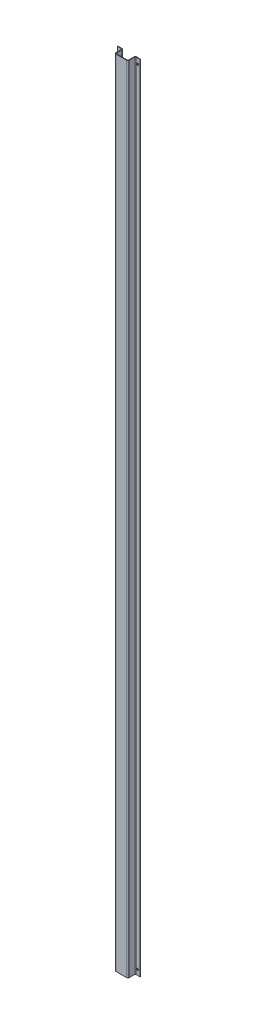
from build123d import *

# Parameters (mm, degrees)
SKETCH1_W                      = 50
SKETCH1_H                      = 3000
BASE_FLANGE1_DEPTH             = 2
EDGE_FLANGE1_STRIP_W           = 13
EDGE_FLANGE1_STRIP_H           = 2
EDGE_FLANGE1_STRIP_CUT_DEPTH   = 3000
EDGE_FLANGE1_STRIP_2_W         = 13
EDGE_FLANGE1_STRIP_2_H         = 2
EDGE_FLANGE1_STRIP_CUT_2_DEPTH = 3000
EDGE_FLANGE1_DEPTH             = 3000
EDGE_FLANGE1_BEND_DEPTH        = 3000
EDGE_FLANGE2_STRIP_W           = 13
EDGE_FLANGE2_STRIP_H           = 2
EDGE_FLANGE2_STRIP_CUT_DEPTH   = 3000
EDGE_FLANGE2_STRIP_2_W         = 13
EDGE_FLANGE2_STRIP_2_H         = 2
EDGE_FLANGE2_STRIP_CUT_2_DEPTH = 3000
EDGE_FLANGE2_DEPTH             = 3000
EDGE_FLANGE2_BEND_DEPTH        = 3000
SKETCH18_R                     = 3.5
CUT_EXTRUDE1_DEPTH             = 10
MIRROR2_COPY_1_SKETCH_R        = 3.5
MIRROR2_COPY_1_DEPTH           = 10


# Sheet-metal steps are written as plain solids
with BuildPart() as part:
    # Sketch1 → Base-Flange1 (new body)
    with BuildSketch(Plane.XY):
        Rectangle(SKETCH1_W, SKETCH1_H)
    extrude(amount=-BASE_FLANGE1_DEPTH)

    # Edge-Flange1 strip (across the edge) → Edge-Flange1 strip cut (cut)
    with BuildSketch(Plane(origin=(25, 1500, -2), x_dir=(-1, 0, 0), z_dir=(0, -1, 0))):
        with Locations((-2, -1)):
            Rectangle(EDGE_FLANGE1_STRIP_W, EDGE_FLANGE1_STRIP_H)
    extrude(amount=EDGE_FLANGE1_STRIP_CUT_DEPTH, mode=Mode.SUBTRACT)

    # Edge-Flange1 strip 2 (across the edge) → Edge-Flange1 strip cut 2 (cut)
    with BuildSketch(Plane(origin=(-25, -1500, -2), x_dir=(1, 0, 0), z_dir=(0, 1, 0))):
        with Locations((-2, -1)):
            Rectangle(EDGE_FLANGE1_STRIP_2_W, EDGE_FLANGE1_STRIP_2_H)
    extrude(amount=EDGE_FLANGE1_STRIP_CUT_2_DEPTH, mode=Mode.SUBTRACT)

    # Edge-Flange1 section (across the edge) → Edge-Flange1 (add)
    with BuildSketch(Plane(origin=(25, 1500, -2), x_dir=(-1, 0, 0), z_dir=(0, -1, 0))):
        with BuildLine():
            Line((0, 2.5), (0, 28))
            Line((0, 28), (2, 28))
            Line((2, 28), (2, 2.5))
            ThreePointArc((2, 2.5), (2.732233047, 0.732233047), (4.5, 0))
            Line((4.5, 0), (4.5, -2))
            ThreePointArc((4.5, -2), (1.318019485, -0.681980515), (0, 2.5))
        make_face()
    extrude(amount=EDGE_FLANGE1_DEPTH)

    # Edge-Flange1 section 2 (across the edge) → Edge-Flange1 bend (add)
    with BuildSketch(Plane(origin=(-25, -1500, -2), x_dir=(1, 0, 0), z_dir=(0, 1, 0))):
        with BuildLine():
            Line((0, 2.5), (0, 28))
            Line((0, 28), (2, 28))
            Line((2, 28), (2, 2.5))
            ThreePointArc((2, 2.5), (2.732233047, 0.732233047), (4.5, 0))
            Line((4.5, 0), (4.5, -2))
            ThreePointArc((4.5, -2), (1.318019485, -0.681980515), (0, 2.5))
        make_face()
    extrude(amount=EDGE_FLANGE1_BEND_DEPTH)

    # Edge-Flange2 strip (across the edge) → Edge-Flange2 strip cut (cut)
    with BuildSketch(Plane(origin=(-25, 1500, -30), x_dir=(0, 0, 1), z_dir=(0, -1, 0))):
        with Locations((-2, -1)):
            Rectangle(EDGE_FLANGE2_STRIP_W, EDGE_FLANGE2_STRIP_H)
    extrude(amount=EDGE_FLANGE2_STRIP_CUT_DEPTH, mode=Mode.SUBTRACT)

    # Edge-Flange2 strip 2 (across the edge) → Edge-Flange2 strip cut 2 (cut)
    with BuildSketch(Plane(origin=(25, -1500, -30), x_dir=(0, 0, 1), z_dir=(0, 1, 0))):
        with Locations((-2, -1)):
            Rectangle(EDGE_FLANGE2_STRIP_2_W, EDGE_FLANGE2_STRIP_2_H)
    extrude(amount=EDGE_FLANGE2_STRIP_CUT_2_DEPTH, mode=Mode.SUBTRACT)

    # Edge-Flange2 section (across the edge) → Edge-Flange2 (add)
    with BuildSketch(Plane(origin=(-25, 1500, -30), x_dir=(0, 0, 1), z_dir=(0, -1, 0))):
        with BuildLine():
            Line((0, 2.5), (0, 18))
            Line((0, 18), (2, 18))
            Line((2, 18), (2, 2.5))
            ThreePointArc((2, 2.5), (2.732233047, 0.732233047), (4.5, 0))
            Line((4.5, 0), (4.5, -2))
            ThreePointArc((4.5, -2), (1.318019485, -0.681980515), (0, 2.5))
        make_face()
    extrude(amount=EDGE_FLANGE2_DEPTH)

    # Edge-Flange2 section 2 (across the edge) → Edge-Flange2 bend (add)
    with BuildSketch(Plane(origin=(25, -1500, -30), x_dir=(0, 0, 1), z_dir=(0, 1, 0))):
        with BuildLine():
            Line((0, 2.5), (0, 18))
            Line((0, 18), (2, 18))
            Line((2, 18), (2, 2.5))
            ThreePointArc((2, 2.5), (2.732233047, 0.732233047), (4.5, 0))
            Line((4.5, 0), (4.5, -2))
            ThreePointArc((4.5, -2), (1.318019485, -0.681980515), (0, 2.5))
        make_face()
    extrude(amount=EDGE_FLANGE2_BEND_DEPTH)

    # Sketch18 → Cut-Extrude1 (cut)
    with BuildSketch(Plane.XY.offset(-28)):
        with Locations((-34, -1480)):
            Circle(SKETCH18_R)
    cut_extrude1 = extrude(amount=-CUT_EXTRUDE1_DEPTH, mode=Mode.SUBTRACT)

    # Mirror1: Cut-Extrude1 across plane
    add(cut_extrude1.mirror(Plane.ZX), mode=Mode.SUBTRACT)

    # Mirror2: Cut-Extrude1 across plane
    add(cut_extrude1.mirror(Plane(origin=(0, 0, 0), x_dir=(0, 0, 1), z_dir=(1, 0, 0))), mode=Mode.SUBTRACT)

    # Mirror2 copy 1 sketch → Mirror2 copy 1 (cut)
    with BuildSketch(Plane(origin=(0, 0, -28), x_dir=(-1, 0, 0), z_dir=(0, 0, 1))):
        with Locations((-34, -1480)):
            Circle(MIRROR2_COPY_1_SKETCH_R)
    extrude(amount=-MIRROR2_COPY_1_DEPTH, mode=Mode.SUBTRACT)


solid = part.part
